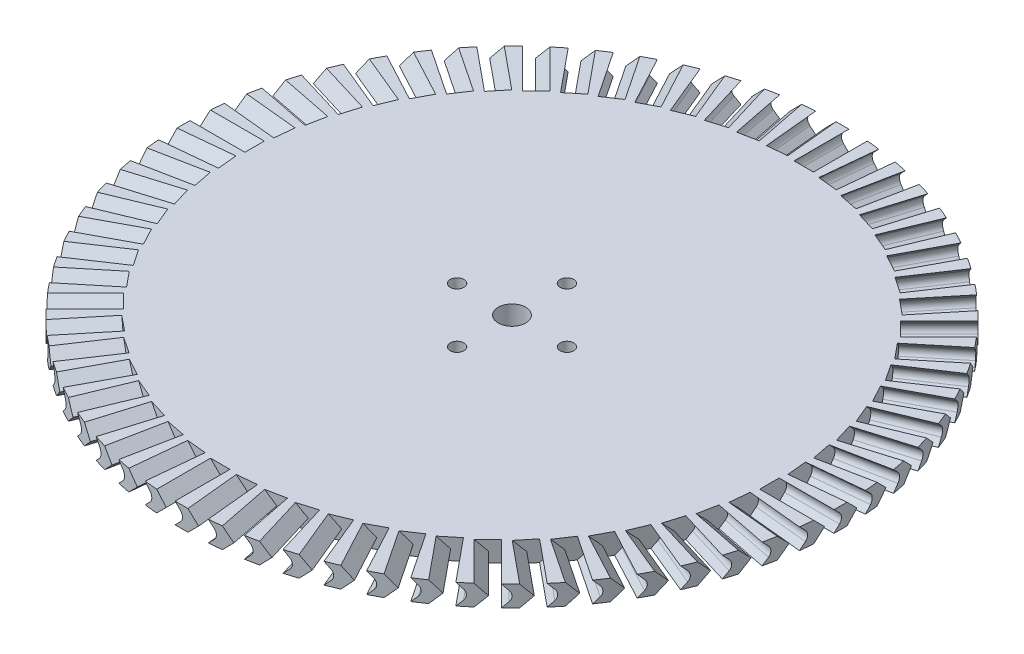
from build123d import *

# Parameters (mm, degrees)
SKETCH1_R           = 152.4
SKETCH1_R_2         = 6.35
SKETCH1_R_3         = 3.175
BOSS_EXTRUDE1_DEPTH = 9.525
CUT_EXTRUDE1_DEPTH  = 25.4
CIRPATTERN1_COUNT   = 64


with BuildPart() as part:
    # Sketch1 → Boss-Extrude1 (new body)
    with BuildSketch(Plane(origin=(0, 0, 0), x_dir=(1, 0, 0), z_dir=(0, 1, 0))):
        Circle(SKETCH1_R)
        Circle(SKETCH1_R_2, mode=Mode.SUBTRACT)
        with Locations((0, 25.4)):
            Circle(SKETCH1_R_3, mode=Mode.SUBTRACT)
        with Locations((25.4, 0)):
            Circle(SKETCH1_R_3, mode=Mode.SUBTRACT)
        with Locations((0, -25.4)):
            Circle(SKETCH1_R_3, mode=Mode.SUBTRACT)
        with Locations((-25.4, 0)):
            Circle(SKETCH1_R_3, mode=Mode.SUBTRACT)
    extrude(amount=BOSS_EXTRUDE1_DEPTH)

    # Sketch2 → Cut-Extrude1 (cut)
    with BuildSketch(Plane.XY.offset(152.4)):
        with BuildLine():
            Line((-3.447371939, 0), (-0.92993597, 2.51743597))
            ThreePointArc((-0.92993597, 2.51743597), (0, 4.7625), (-0.92993597, 7.00756403))
            Line((-0.92993597, 7.00756403), (-3.447371939, 9.525))
            Line((-3.447371939, 9.525), (-12.427628061, 9.525))
            Line((-12.427628061, 9.525), (-7.665128061, 4.7625))
            Line((-7.665128061, 4.7625), (-12.427628061, 0))
            Line((-12.427628061, 0), (-3.447371939, 0))
        make_face()
    cut_extrude1 = extrude(amount=-CUT_EXTRUDE1_DEPTH, mode=Mode.SUBTRACT)

    # CirPattern1: Cut-Extrude1 ×64 about axis
    cirpattern1_axis = Axis((0, 9.525, 0), (0, -1, 0))
    for i in range(1, CIRPATTERN1_COUNT):
        add(cut_extrude1.rotate(cirpattern1_axis, i * 360 / CIRPATTERN1_COUNT), mode=Mode.SUBTRACT)


solid = part.part
